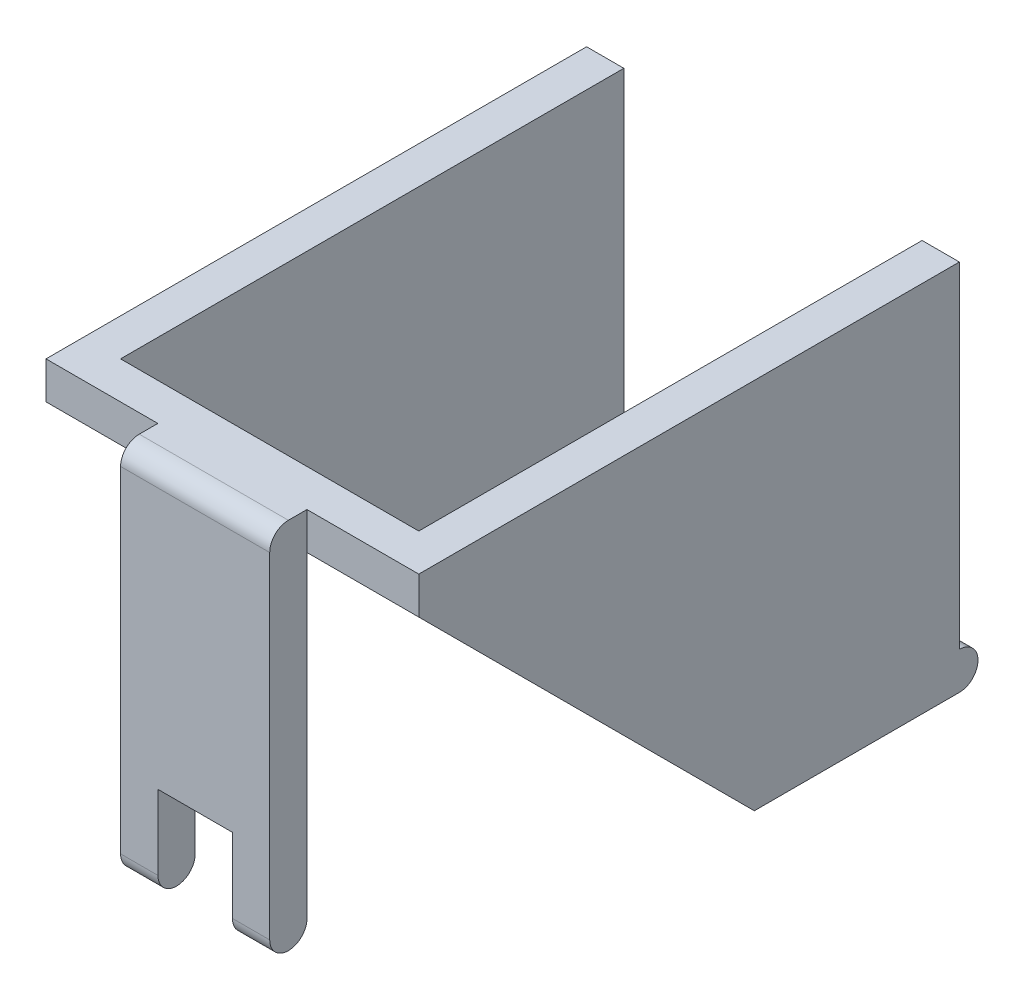
from build123d import *

# Parameters (mm, degrees)
EXTRUDE_3_DEPTH     = 20
SKETCH_4_W          = 6
SKETCH_4_H          = 1.997420006
CUT_EXTRUDE_1_DEPTH = 20
EXTRUDE_START       = -8
EXTRUDE_4_DEPTH     = 8
SKETCH_6_R          = 1
EXTRUDE_5_DEPTH     = 20
SKETCH_7_W          = 16
SKETCH_7_H          = 28.677583324
CUT_EXTRUDE_3_DEPTH = 18
SKETCH_8_W          = 4
SKETCH_8_H          = 6.365219316
CUT_EXTRUDE_4_DEPTH = 10
SKETCH_9_W          = 8
SKETCH_9_H          = 4
CUT_EXTRUDE_5_DEPTH = 10


with BuildPart() as part:
    # 草图3 → 凸台-拉伸3 (new body)
    with BuildSketch(Plane(origin=(0, 0, 0), x_dir=(0, 0, -1), z_dir=(1, 0, 0))):
        with BuildLine():
            Line((-14.292893219, 8.292893219), (4, -10))
            Line((4, -10), (15, -10))
            Line((15, -10), (15, 10))
            Line((15, 10), (-15, 10))
            ThreePointArc((-15, 10), (-15.923879533, 8.617316568), (-14.292893219, 8.292893219))
        make_face()
    extrude(amount=EXTRUDE_3_DEPTH)

    # 草图4 → 切除-拉伸1 (cut)
    with BuildSketch(Plane(origin=(0, 10, 0), x_dir=(1, 0, 0), z_dir=(0, 1, 0))):
        with Locations((3, -15.001289997)):
            Rectangle(SKETCH_4_W, SKETCH_4_H)
        with Locations((17, -15.001289997)):
            Rectangle(SKETCH_4_W, SKETCH_4_H)
    extrude(amount=-CUT_EXTRUDE_1_DEPTH, mode=Mode.SUBTRACT)

    # 草图5 → 凸台-拉伸4 (add)
    with BuildSketch(Plane(origin=(14, 0, 0), x_dir=(0, 0, -1), z_dir=(1, 0, 0)).offset(EXTRUDE_START)):
        with BuildLine():
            Line((-14, 9), (-14, -9))
            ThreePointArc((-14, -9), (-15, -10), (-16, -9))
            Line((-16, -9), (-16, 9))
            ThreePointArc((-16, 9), (-15, 10), (-14, 9))
        make_face()
    extrude(amount=EXTRUDE_4_DEPTH)

    # 草图6 → 凸台-拉伸5 (add)
    with BuildSketch(Plane(origin=(20, 0, 0), x_dir=(0, 0, -1), z_dir=(1, 0, 0))):
        with Locations((15, -9)):
            Circle(SKETCH_6_R)
    extrude(amount=-EXTRUDE_5_DEPTH)

    # 草图7 → 切除-拉伸3 (cut)
    with BuildSketch(Plane(origin=(0, 10, 0), x_dir=(1, 0, 0), z_dir=(0, 1, 0))):
        with Locations((10, 2.336211668)):
            Rectangle(SKETCH_7_W, SKETCH_7_H)
    extrude(amount=-CUT_EXTRUDE_3_DEPTH, mode=Mode.SUBTRACT)

    # 草图8 → 切除-拉伸4 (cut)
    with BuildSketch(Plane.XY.offset(16)):
        with Locations((10, -8.182609658)):
            Rectangle(SKETCH_8_W, SKETCH_8_H)
    extrude(amount=-CUT_EXTRUDE_4_DEPTH, mode=Mode.SUBTRACT)

    # 草图9 → 切除-拉伸5 (cut)
    with BuildSketch(Plane(origin=(0, -8, 0), x_dir=(1, 0, 0), z_dir=(0, 1, 0))):
        with Locations((10, 14)):
            Rectangle(SKETCH_9_W, SKETCH_9_H)
    extrude(amount=-CUT_EXTRUDE_5_DEPTH, mode=Mode.SUBTRACT)


solid = part.part
